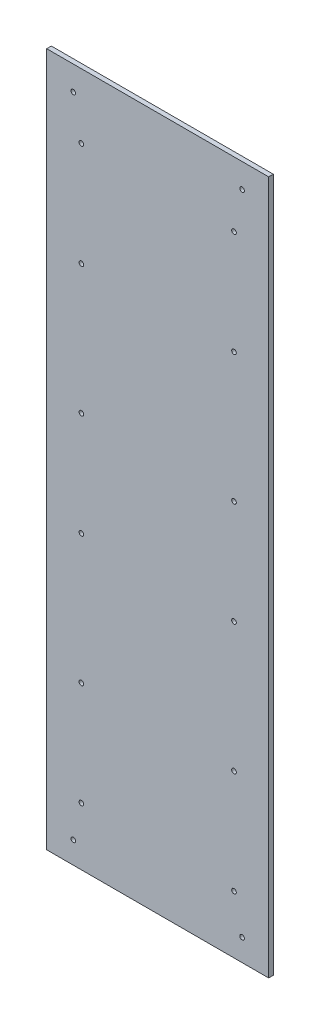
from build123d import *

# Parameters (mm, degrees)
SKETCH1_W           = 96
SKETCH1_H           = 300
BOSS_EXTRUDE1_DEPTH = 2
SKETCH2_R           = 1
CUT_EXTRUDE1_DEPTH  = 10
SKETCH3_R           = 1
CUT_EXTRUDE2_DEPTH  = 10


with BuildPart() as part:
    # Sketch1 → Boss-Extrude1 (new body)
    with BuildSketch(Plane.XY):
        Rectangle(SKETCH1_W, SKETCH1_H)
    extrude(amount=BOSS_EXTRUDE1_DEPTH)

    # Sketch2 → Cut-Extrude1 (cut)
    with BuildSketch(Plane.XY.offset(2)):
        with Locations((-33, 122)):
            Circle(SKETCH2_R)
        with Locations((-33, 77)):
            Circle(SKETCH2_R)
        with Locations((-33, -125)):
            Circle(SKETCH2_R)
        with Locations((-33, -80)):
            Circle(SKETCH2_R)
        with Locations((-33, -24)):
            Circle(SKETCH2_R)
        with Locations((-33, 21)):
            Circle(SKETCH2_R)
        with Locations((33, 21)):
            Circle(SKETCH2_R)
        with Locations((33, -24)):
            Circle(SKETCH2_R)
        with Locations((33, -80)):
            Circle(SKETCH2_R)
        with Locations((33, -125)):
            Circle(SKETCH2_R)
        with Locations((33, 77)):
            Circle(SKETCH2_R)
        with Locations((33, 122)):
            Circle(SKETCH2_R)
    extrude(amount=-CUT_EXTRUDE1_DEPTH, mode=Mode.SUBTRACT)

    # Sketch3 → Cut-Extrude2 (cut)
    with BuildSketch(Plane.XY.offset(2)):
        with Locations((-36.5, 139.5)):
            Circle(SKETCH3_R)
        with Locations((36.5, 139.5)):
            Circle(SKETCH3_R)
        with Locations((-36.5, -140.5)):
            Circle(SKETCH3_R)
        with Locations((36.5, -140.5)):
            Circle(SKETCH3_R)
    extrude(amount=-CUT_EXTRUDE2_DEPTH, mode=Mode.SUBTRACT)


solid = part.part
